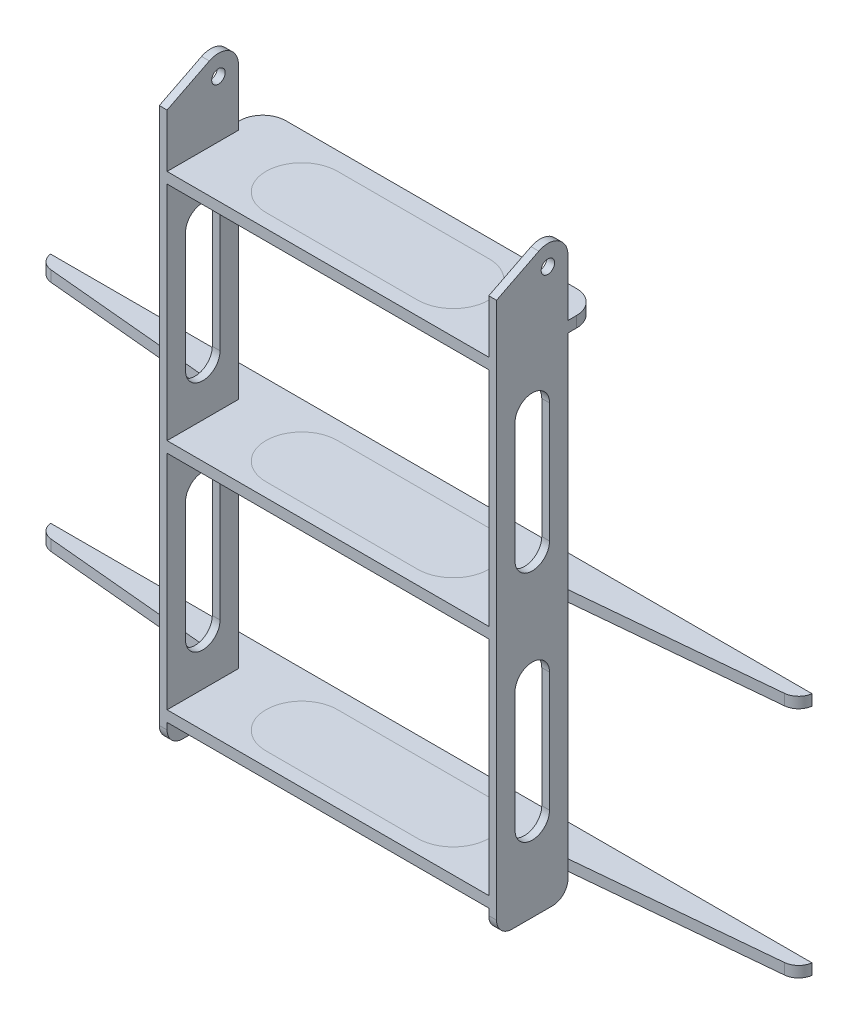
from build123d import *

# Parameters (mm, degrees)
SKETCH1_W           = 1237.47
SKETCH1_H           = 14
BOSS_EXTRUDE1_DEPTH = 133
LPATTERN3_COUNT     = 3
LPATTERN3_PITCH     = 300
CUT_EXTRUDE1_DEPTH  = 882.76981136
SKETCH3_W           = 91.937612072
SKETCH3_H           = 741.26
BOSS_EXTRUDE2_DEPTH = 10
SKETCH4_W           = 304.666106801
SKETCH4_H           = 263.446683033
CUT_EXTRUDE2_DEPTH  = 86
SKETCH5_R           = 8.65
CUT_EXTRUDE3_DEPTH  = 960.88018544
FILLET1_R           = 30
FILLET2_R           = 20
FILLET3_R           = 20
CUT_EXTRUDE4_DEPTH  = 960.88018544


with BuildPart() as part:
    # Sketch1 → Boss-Extrude1 (new body)
    with BuildSketch(Plane.XY):
        Rectangle(SKETCH1_W, SKETCH1_H)
    extrude(amount=BOSS_EXTRUDE1_DEPTH)


with BuildPart() as lpattern3_1:
    # LPattern3: pattern copy
    add(part.part.moved(Location(Vector(0, -1, 0) * (1 * LPATTERN3_PITCH))))


with BuildPart() as lpattern3_2:
    # LPattern3: pattern copy
    add(part.part.moved(Location(Vector(0, -1, 0) * (2 * LPATTERN3_PITCH))))


with BuildPart() as cut_extrude1_tool:
    # Sketch2 → Cut-Extrude1 (new, through all)
    with BuildSketch(Plane(origin=(0, 7, 0), x_dir=(1, 0, 0), z_dir=(0, 1, 0))):
        Polygon((-618.735, 0), (-618.735, -133), (-217.005, -133), (-217.005, -41.062387928), (-488.639842036, -15.767947981), (-489.975, 0), align=None)
        Polygon((217.005, -41.062387928), (488.639842036, -15.767947981), (489.975, 0), (618.735, 0), (618.735, -133), (217.005, -133), align=None)
    extrude(amount=-CUT_EXTRUDE1_DEPTH)


with BuildPart() as part_1:
    add(part.part)

    # Cut-Extrude1: cut by cut_extrude1_tool
    add(cut_extrude1_tool.part, mode=Mode.SUBTRACT)



with BuildPart() as lpattern3_1_1:
    add(lpattern3_1.part)

    # Cut-Extrude1: cut by cut_extrude1_tool
    add(cut_extrude1_tool.part, mode=Mode.SUBTRACT)


with BuildPart() as lpattern3_2_1:
    add(lpattern3_2.part)

    # Cut-Extrude1: cut by cut_extrude1_tool
    add(cut_extrude1_tool.part, mode=Mode.SUBTRACT)


with BuildPart() as part_2:
    add(part_1.part)

    add(lpattern3_1_1.part)  # Boss-Extrude2 merges LPattern3_1

    add(lpattern3_2_1.part)  # Boss-Extrude2 merges LPattern3_2
    # Sketch3 → Boss-Extrude2 (add)
    with BuildSketch(Plane.ZY.offset(217.005)):
        with Locations((87.031193964, -264.87)):
            Rectangle(SKETCH3_W, SKETCH3_H)
    boss_extrude2 = extrude(amount=-BOSS_EXTRUDE2_DEPTH)

    # Mirror1: Boss-Extrude2 across plane
    add(boss_extrude2.mirror(Plane(origin=(0, 0, 0), x_dir=(0, 0, 1), z_dir=(1, 0, 0))))

    # Sketch4 → Cut-Extrude2 (cut)
    with BuildSketch(Plane(origin=(0, 7, 0), x_dir=(1, 0, 0), z_dir=(0, 1, 0))):
        with Locations((-369.338053401, -91.037881314)):
            Rectangle(SKETCH4_W, SKETCH4_H)
        with Locations((369.338053401, -91.037881314)):
            Rectangle(SKETCH4_W, SKETCH4_H)
    extrude(amount=-CUT_EXTRUDE2_DEPTH, mode=Mode.SUBTRACT)

    # Sketch5 → Cut-Extrude3 (cut, through all)
    with BuildSketch(Plane.ZY.offset(217.005)):
        with Locations((66.922387928, 79.9)):
            Circle(SKETCH5_R)
        with BuildLine():
            Line((133, 75.48), (78.58674431, 102.979913133))
            ThreePointArc((78.58674431, 102.979913133), (53.374337442, 101.927027217), (41.062387928, 79.9))
            Line((41.062387928, 79.9), (30.442053439, 79.9))
            Line((30.442053439, 79.9), (30.442053439, 120.292255017))
            Line((30.442053439, 120.292255017), (142.138652578, 120.292255017))
            Line((142.138652578, 120.292255017), (142.138652578, 75.48))
            Line((142.138652578, 75.48), (133, 75.48))
        make_face()
    extrude(amount=-CUT_EXTRUDE3_DEPTH, mode=Mode.SUBTRACT)

    # Fillet1
    fillet1_edges = [part_2.edges().sort_by_distance(p)[0] for p in [
        (-217.005, 0, 0),
        (217.005, 0, 0),
    ]]
    fillet(fillet1_edges, radius=FILLET1_R)

    # Fillet2
    fillet2_edges = [part_2.edges().sort_by_distance(p)[0] for p in [
        (212.005, -635.5, 133),
        (212.005, -635.5, 41.062387928),
        (-212.005, -635.5, 41.062387928),
        (-212.005, -635.5, 133),
    ]]
    fillet(fillet2_edges, radius=FILLET2_R)

    # Fillet3
    # the kernel refuses this fillet: 20 mm, written as the material it takes off along each edge
    with BuildSketch(Plane(origin=(488.639842036, -251.216899092, 15.767947981), x_dir=(-0.995692394104561, 0, 0.0927181553005003), z_dir=(0, -1, 0))) as fillet3_piece_1:
        with BuildLine():
            CenterArc((16.713240363, 20), FILLET3_R, 192.778841583, 77.221158417)
            Line((-2.79138168, 15.576232492), (-3.181474121, 15.487757141))
            ThreePointArc((-3.181474121, 15.487757141), (-1.789418438, 7.717557206), (-0.393727599, -0.07055904))
            Line((-0.393727599, -0.07055904), (0, -0.4))
            Line((0, -0.4), (16.713240363, -0.4))
            Line((16.713240363, -0.4), (16.713240363, 0))
        make_face()
    extrude(amount=97.566201815, mode=Mode.SUBTRACT)
    with BuildSketch(Plane(origin=(488.639842036, -551.216899092, 15.767947981), x_dir=(0.08437350613868201, 0, -0.996434198259908), z_dir=(0, -1, 0))) as fillet3_piece_2:
        with BuildLine():
            CenterArc((16.738204459, -19.979111965), FILLET3_R, 92.618841583, 77.221158417)
            Line((-2.948175473, -16.451159984), (-3.341903071, -16.380600944))
            Line((-3.341903071, -16.380600944), (-0.393727599, 0.07055904))
            Line((-0.393727599, 0.07055904), (0, 0.4))
            ThreePointArc((0, 0.4), (7.912187282, 0.4), (15.806097965, 0.399582239))
            Line((15.806097965, 0.399582239), (15.824374563, 0))
        make_face()
    extrude(amount=97.566201815, mode=Mode.SUBTRACT)
    with BuildSketch(Plane(origin=(-488.639842036, -551.216899092, 15.767947981), x_dir=(0.995692394104561, 0, 0.0927181553005003), z_dir=(0, -1, 0)), Plane(origin=(-488.639842036, -251.216899092, 15.767947981), x_dir=(0.995692394104561, 0, 0.0927181553005003), z_dir=(0, -1, 0))) as fillet3_piece_3:
        with BuildLine():
            CenterArc((16.713240363, -20), FILLET3_R, 90, 77.221158417)
            Line((-2.79138168, -15.576232492), (-3.181474121, -15.487757141))
            ThreePointArc((-3.181474121, -15.487757141), (-1.789418438, -7.717557206), (-0.393727599, 0.07055904))
            Line((-0.393727599, 0.07055904), (0, 0.4))
            Line((0, 0.4), (16.713240363, 0.4))
            Line((16.713240363, 0.4), (16.713240363, 0))
        make_face()
    extrude(amount=97.566201815, mode=Mode.SUBTRACT)

    # Sketch6 → Cut-Extrude4 (cut, through all)
    with BuildSketch(Plane.ZY.offset(217.005)):
        with BuildLine():
            Line((109.261193964, -73.05), (109.261193964, -226.95))
            ThreePointArc((109.261193964, -226.95), (87.031193964, -249.18), (64.801193964, -226.95))
            Line((64.801193964, -226.95), (64.801193964, -73.05))
            ThreePointArc((64.801193964, -73.05), (87.031193964, -50.82), (109.261193964, -73.05))
        make_face()
        with BuildLine():
            Line((109.261193964, -526.95), (109.261193964, -373.05))
            ThreePointArc((109.261193964, -373.05), (87.031193964, -350.82), (64.801193964, -373.05))
            Line((64.801193964, -373.05), (64.801193964, -526.95))
            ThreePointArc((64.801193964, -526.95), (87.031193964, -549.18), (109.261193964, -526.95))
        make_face()
    extrude(amount=-CUT_EXTRUDE4_DEPTH, mode=Mode.SUBTRACT)


solid = part_2.part
